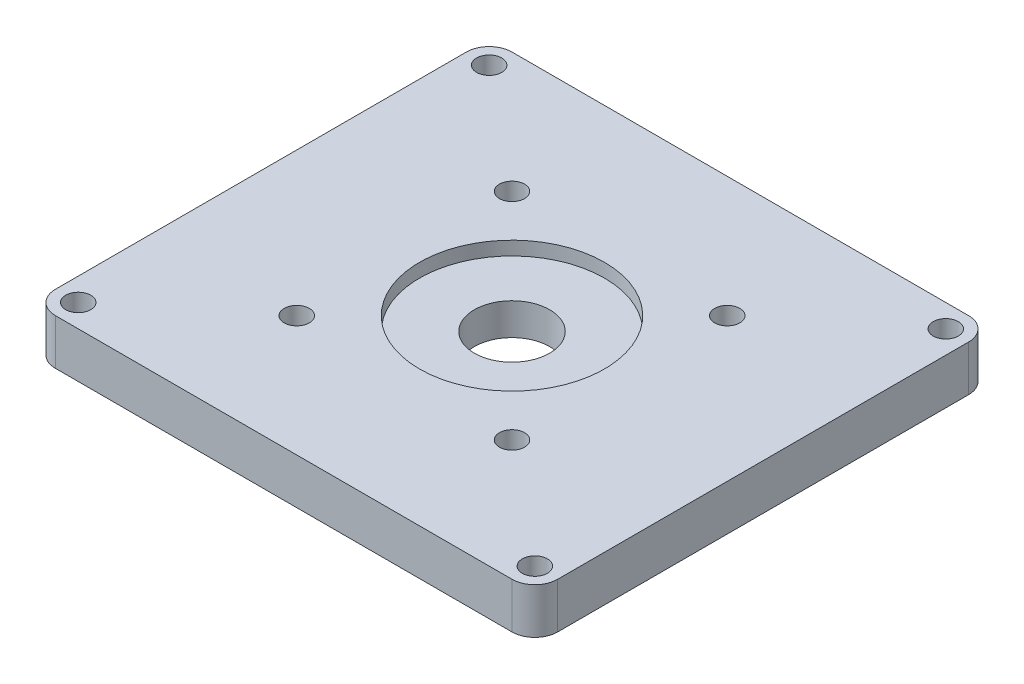
from build123d import *

# Parameters (mm, degrees)
SKETCH2_W           = 110
SKETCH2_H           = 100
SKETCH2_R           = 2.75
BOSS_EXTRUDE1_DEPTH = 10
SKETCH3_R           = 8.25
CUT_EXTRUDE1_DEPTH  = 10
SKETCH4_R           = 20.25
CUT_EXTRUDE2_DEPTH  = 3
SKETCH5_R           = 6.25
CUT_EXTRUDE3_DEPTH  = 5.5
FILLET1_R           = 5


with BuildPart() as part:
    # Sketch2 → Boss-Extrude1 (new body)
    with BuildSketch(Plane(origin=(0, 0, 0), x_dir=(1, 0, 0), z_dir=(0, 1, 0))):
        with Locations((23.57, 23.57)):
            Rectangle(SKETCH2_W, SKETCH2_H)
        Circle(SKETCH2_R, mode=Mode.SUBTRACT)
        with Locations((0, 47.14)):
            Circle(SKETCH2_R, mode=Mode.SUBTRACT)
        with Locations((47.14, 47.14)):
            Circle(SKETCH2_R, mode=Mode.SUBTRACT)
        with Locations((47.14, 0)):
            Circle(SKETCH2_R, mode=Mode.SUBTRACT)
        with Locations((73.57, 68.57)):
            Circle(SKETCH2_R, mode=Mode.SUBTRACT)
        with Locations((73.57, -21.43)):
            Circle(SKETCH2_R, mode=Mode.SUBTRACT)
        with Locations((-26.43, -21.43)):
            Circle(SKETCH2_R, mode=Mode.SUBTRACT)
        with Locations((-26.43, 68.57)):
            Circle(SKETCH2_R, mode=Mode.SUBTRACT)
    extrude(amount=BOSS_EXTRUDE1_DEPTH)

    # Sketch3 → Cut-Extrude1 (cut)
    with BuildSketch(Plane(origin=(0, 10, 0), x_dir=(1, 0, 0), z_dir=(0, 1, 0))):
        with Locations((23.57, 23.57)):
            Circle(SKETCH3_R)
    extrude(amount=-CUT_EXTRUDE1_DEPTH, mode=Mode.SUBTRACT)

    # Sketch4 → Cut-Extrude2 (cut)
    with BuildSketch(Plane(origin=(0, 10, 0), x_dir=(1, 0, 0), z_dir=(0, 1, 0))):
        with Locations((23.57, 23.57)):
            Circle(SKETCH4_R)
    extrude(amount=-CUT_EXTRUDE2_DEPTH, mode=Mode.SUBTRACT)

    # Sketch5 → Cut-Extrude3 (cut)
    with BuildSketch(Plane.XZ):
        Circle(SKETCH5_R)
        with Locations((47.14, 0)):
            Circle(SKETCH5_R)
        with Locations((47.14, -47.14)):
            Circle(SKETCH5_R)
        with Locations((0, -47.14)):
            Circle(SKETCH5_R)
    extrude(amount=-CUT_EXTRUDE3_DEPTH, mode=Mode.SUBTRACT)

    # Fillet1
    fillet1_edges = [part.edges().sort_by_distance(p)[0] for p in [
        (-31.43, 5, -73.57),
        (78.57, 5, -73.57),
        (78.57, 5, 26.43),
        (-31.43, 5, 26.43),
    ]]
    fillet(fillet1_edges, radius=FILLET1_R)


solid = part.part
